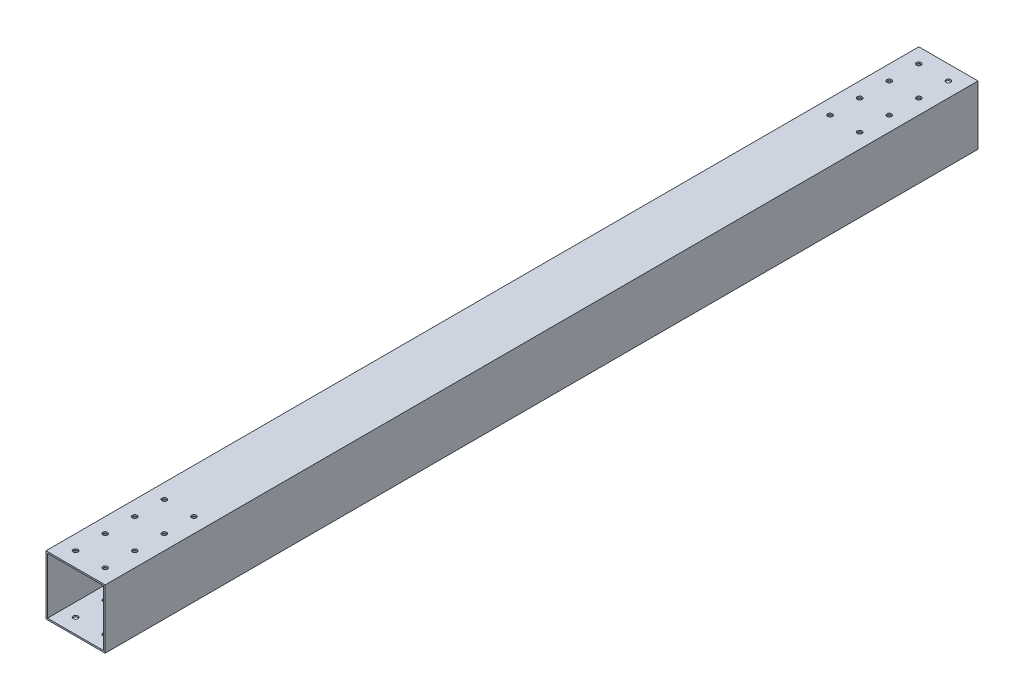
from build123d import *

# Parameters (mm, degrees)
SKETCH_1_W          = 40
SKETCH_1_H          = 40
SKETCH_1_W_2        = 38
SKETCH_1_H_2        = 38
EXTRUDE_1_DEPTH     = 295
SKETCH_2_R          = 1.6
CUT_EXTRUDE_1_DEPTH = 299.370574957


with BuildPart() as part:
    # 草图1 → 凸台-拉伸1 (new, symmetric)
    with BuildSketch(Plane.XY):
        Rectangle(SKETCH_1_W, SKETCH_1_H)
        Rectangle(SKETCH_1_W_2, SKETCH_1_H_2, mode=Mode.SUBTRACT)
    extrude(amount=EXTRUDE_1_DEPTH, both=True)

    # 草图2 → 切除-拉伸1 (cut, through all)
    with BuildSketch(Plane(origin=(0, 20, 0), x_dir=(1, 0, 0), z_dir=(0, 1, 0))):
        with Locations((-10, -285)):
            Circle(SKETCH_2_R)
        with Locations((10, -285)):
            Circle(SKETCH_2_R)
        with Locations((-10, -265)):
            Circle(SKETCH_2_R)
        with Locations((10, -265)):
            Circle(SKETCH_2_R)
        with Locations((-10, -245)):
            Circle(SKETCH_2_R)
        with Locations((10, -245)):
            Circle(SKETCH_2_R)
        with Locations((-10, -225)):
            Circle(SKETCH_2_R)
        with Locations((10, -225)):
            Circle(SKETCH_2_R)
        with Locations((10, 225)):
            Circle(SKETCH_2_R)
        with Locations((-10, 225)):
            Circle(SKETCH_2_R)
        with Locations((10, 245)):
            Circle(SKETCH_2_R)
        with Locations((-10, 245)):
            Circle(SKETCH_2_R)
        with Locations((10, 265)):
            Circle(SKETCH_2_R)
        with Locations((-10, 265)):
            Circle(SKETCH_2_R)
        with Locations((10, 285)):
            Circle(SKETCH_2_R)
        with Locations((-10, 285)):
            Circle(SKETCH_2_R)
    extrude(amount=-CUT_EXTRUDE_1_DEPTH, mode=Mode.SUBTRACT)


solid = part.part
